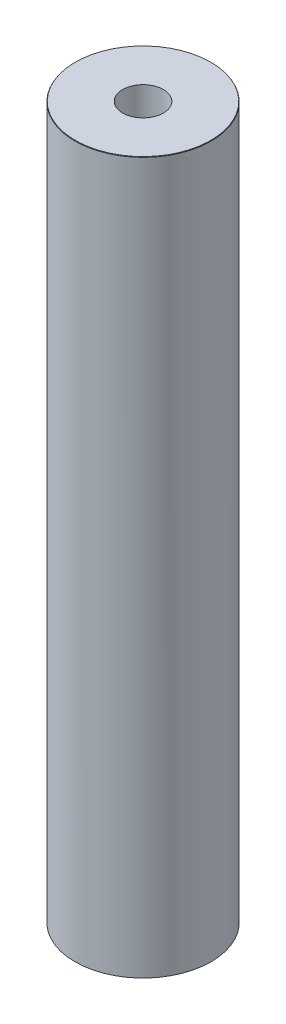
from build123d import *
from OCP.BRepFilletAPI import BRepFilletAPI_MakeChamfer

# Parameters (mm, degrees)
SKETCH1_R           = 55
BOSS_EXTRUDE1_DEPTH = 575.026899896
SKETCH2_R           = 16.465058297
CUT_EXTRUDE1_DEPTH  = 581.263677653
CHAMFER1_SIZE       = 0.407825208
CHAMFER1_SIZE2      = 0.235457994


with BuildPart() as part:
    # Sketch1 → Boss-Extrude1 (new body)
    with BuildSketch(Plane(origin=(0, 0, 0), x_dir=(1, 0, 0), z_dir=(0, 1, 0))):
        Circle(SKETCH1_R)
    extrude(amount=BOSS_EXTRUDE1_DEPTH)

    # Sketch2 → Cut-Extrude1 (cut, through all)
    with BuildSketch(Plane(origin=(0, 0, 0), x_dir=(1, 0, 0), z_dir=(0, 1, 0))):
        Circle(SKETCH2_R)
    extrude(amount=CUT_EXTRUDE1_DEPTH, mode=Mode.SUBTRACT)

    # Chamfer1: one chamfer whose edges measure the first distance from different faces: ONE call of the kernel's chamfer builder (chamfer() names one face for all edges)
    chamfer1_edges_1 = [part.edges().sort_by_distance(p)[0] for p in [
        (-55, 575.026899896, 0),
    ]]
    chamfer1_side_1 = [part.faces().sort_by_distance(p)[0] for p in [
        (-55, 287.513449948, 0),
    ]]
    chamfer1_edges_2 = [part.edges().sort_by_distance(p)[0] for p in [
        (-55, 0, 0),
    ]]
    chamfer1_side_2 = [part.faces().sort_by_distance(p)[0] for p in [
        (-53.444365081, 0, 0),
    ]]
    chamfer1 = BRepFilletAPI_MakeChamfer(part.part.solid().wrapped)
    for e in chamfer1_edges_1:
        chamfer1.Add(CHAMFER1_SIZE, CHAMFER1_SIZE2, e.wrapped, chamfer1_side_1[0].wrapped)  # the first distance lies on this face
    for e in chamfer1_edges_2:
        chamfer1.Add(CHAMFER1_SIZE, CHAMFER1_SIZE2, e.wrapped, chamfer1_side_2[0].wrapped)  # the first distance lies on this face
    add(Compound.cast(chamfer1.Shape()), mode=Mode.REPLACE)


solid = part.part
